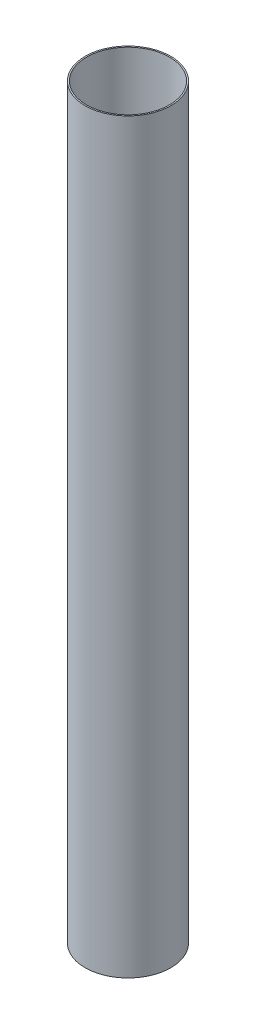
from build123d import *

# Parameters (mm, degrees)
SKETCH1_R           = 39.37
SKETCH1_R_2         = 38.1
BOSS_EXTRUDE2_DEPTH = 685.8


with BuildPart() as part:
    # Sketch1 → Boss-Extrude2 (new body)
    with BuildSketch(Plane(origin=(0, 0, 0), x_dir=(1, 0, 0), z_dir=(0, 1, 0))):
        Circle(SKETCH1_R)
        Circle(SKETCH1_R_2, mode=Mode.SUBTRACT)
    extrude(amount=BOSS_EXTRUDE2_DEPTH)


solid = part.part
